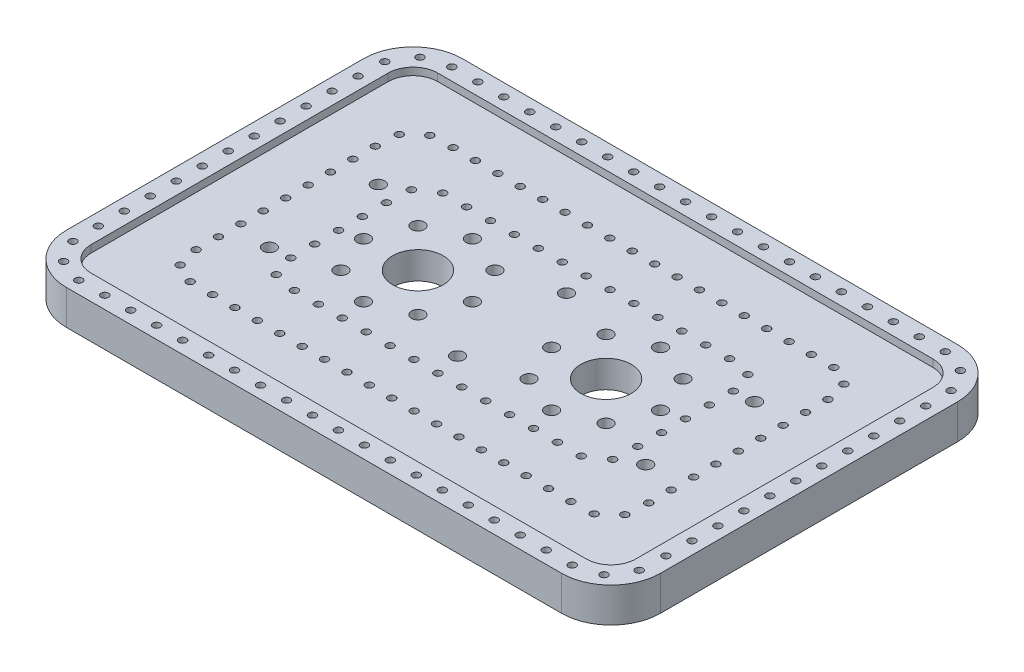
from build123d import *

# Parameters (mm, degrees)
SKETCH1_W                                        = 120
SKETCH1_H                                        = 80
BOSS_EXTRUDE1_DEPTH                              = 7
SKETCH2_W                                        = 110
SKETCH2_H                                        = 70
CUT_EXTRUDE1_DEPTH                               = 1.5
F_2_6_2_6_DIAMETER_HOLE1_D                       = 2.6
F_10_2_10_2_DIAMETER_HOLE1_D                     = 10.2
CBORE_FOR_M2_HEX_HEAD_MACHINE_SCREW1_D           = 2.6
CBORE_FOR_M2_HEX_HEAD_MACHINE_SCREW1_CBORE_D     = 5
CBORE_FOR_M2_HEX_HEAD_MACHINE_SCREW1_CBORE_DEPTH = 3
FILLET1_R                                        = 10
FILLET3_R                                        = 5
F_1_5MM_DOWEL_HOLE1_D                            = 1.5
CRVPATTERN1_OUTLINE_R                            = 0.75
CRVPATTERN1_DEPTH                                = 7
F_1_5MM_DOWEL_HOLE2_D                            = 1.5
CRVPATTERN3_OUTLINE_R                            = 0.75
CRVPATTERN3_DEPTH                                = 5.5
F_1_5MM_DOWEL_HOLE3_D                            = 1.5
CRVPATTERN4_OUTLINE_R                            = 0.75
CRVPATTERN4_DEPTH                                = 5.5


# Read off the part's stored shape, not the designer's step: CrvPattern1, CrvPattern3, CrvPattern4
with BuildPart() as part:
    # Sketch1 → Boss-Extrude1 (new body)
    with BuildSketch(Plane(origin=(0, 7, 0), x_dir=(1, 0, 0), z_dir=(0, 1, 0))):
        Rectangle(SKETCH1_W, SKETCH1_H)
    extrude(amount=-BOSS_EXTRUDE1_DEPTH)

    # Sketch2 → Cut-Extrude1 (cut)
    with BuildSketch(Plane(origin=(0, 7, 0), x_dir=(-1, 0, 0), z_dir=(0, 1, 0))):
        Rectangle(SKETCH2_W, SKETCH2_H)
    extrude(amount=-CUT_EXTRUDE1_DEPTH, mode=Mode.SUBTRACT)

    # Ø2.6 (2.6) Diameter Hole1 (through all)
    with Locations(Plane(origin=(0, 5.5, 0), x_dir=(1, 0, 0), z_dir=(0, 1, 0))):
        with Locations((-38, -11), (0, 11), (-11.221825407, -7.778174593), (-19, -11), (-26.778174593, -7.778174593), (-26.778174593, 7.778174593), (-19, 11), (-11.221825407, 7.778174593), (11.221825407, 7.778174593), (19, 11), (26.778174593, 7.778174593), (30, 0), (26.778174593, -7.778174593), (19, -11), (11.221825407, -7.778174593), (-8, 0)):
            Hole(F_2_6_2_6_DIAMETER_HOLE1_D / 2)

    # Ø10.2 (10.2) Diameter Hole1 (through all)
    with Locations(Plane(origin=(0, 5.5, 0), x_dir=(1, 0, 0), z_dir=(0, 1, 0))):
        with Locations((19, 0), (-19, 0)):
            Hole(F_10_2_10_2_DIAMETER_HOLE1_D / 2)

    # CBORE for M2 Hex Head Machine Screw1 (through all)
    with Locations(Plane(origin=(0, 0, 0), x_dir=(-1, 0, 0), z_dir=(0, -1, 0))):
        with Locations((-8, 0), (30, 0), (38, 11), (-38, 11), (0, -11), (-38, -11), (26.778174593, -7.778174593), (38, -11), (19, -11), (11.221825407, -7.778174593), (8, 0), (11.221825407, 7.778174593), (19, 11), (26.778174593, 7.778174593), (0, 11), (-11.221825407, 7.778174593), (-19, 11), (-26.778174593, 7.778174593), (-30, 0), (-26.778174593, -7.778174593), (-19, -11), (-11.221825407, -7.778174593)):
            CounterBoreHole(CBORE_FOR_M2_HEX_HEAD_MACHINE_SCREW1_D / 2, CBORE_FOR_M2_HEX_HEAD_MACHINE_SCREW1_CBORE_D / 2, CBORE_FOR_M2_HEX_HEAD_MACHINE_SCREW1_CBORE_DEPTH)

    # Fillet1
    fillet1_edges = [part.edges().sort_by_distance(p)[0] for p in [
        (-60, 3.5, -40),
        (60, 3.5, -40),
        (60, 3.5, 40),
        (-60, 3.5, 40),
    ]]
    fillet(fillet1_edges, radius=FILLET1_R)

    # Fillet3
    fillet3_edges = [part.edges().sort_by_distance(p)[0] for p in [
        (-55, 6.25, 35),
        (-55, 6.25, -35),
        (55, 6.25, -35),
        (55, 6.25, 35),
    ]]
    fillet(fillet3_edges, radius=FILLET3_R)

    # Ø1.5mm Dowel Hole1 (through all)
    with Locations(Plane(origin=(0, 7, 0), x_dir=(1, 0, 0), z_dir=(0, 1, 0))):
        with Locations((50, 37.5)):
            Hole(F_1_5MM_DOWEL_HOLE1_D / 2)

    # CrvPattern1 outline → CrvPattern1 (cut)
    with BuildSketch(Plane(origin=(0, 0, 0), x_dir=(1, 0, 0), z_dir=(0, 1, 0))):
        with Locations((44.755373003, 37.5)):
            Circle(CRVPATTERN1_OUTLINE_R)
        with Locations((39.510746006, 37.5)):
            Circle(CRVPATTERN1_OUTLINE_R)
        with Locations((34.266119008, 37.5)):
            Circle(CRVPATTERN1_OUTLINE_R)
        with Locations((29.021492011, 37.5)):
            Circle(CRVPATTERN1_OUTLINE_R)
        with Locations((23.776865014, 37.5)):
            Circle(CRVPATTERN1_OUTLINE_R)
        with Locations((18.532238017, 37.5)):
            Circle(CRVPATTERN1_OUTLINE_R)
        with Locations((13.28761102, 37.5)):
            Circle(CRVPATTERN1_OUTLINE_R)
        with Locations((8.042984022, 37.5)):
            Circle(CRVPATTERN1_OUTLINE_R)
        with Locations((2.798357025, 37.5)):
            Circle(CRVPATTERN1_OUTLINE_R)
        with Locations((-2.446269972, 37.5)):
            Circle(CRVPATTERN1_OUTLINE_R)
        with Locations((-7.690896969, 37.5)):
            Circle(CRVPATTERN1_OUTLINE_R)
        with Locations((-12.935523966, 37.5)):
            Circle(CRVPATTERN1_OUTLINE_R)
        with Locations((-18.180150964, 37.5)):
            Circle(CRVPATTERN1_OUTLINE_R)
        with Locations((-23.424777961, 37.5)):
            Circle(CRVPATTERN1_OUTLINE_R)
        with Locations((-28.669404958, 37.5)):
            Circle(CRVPATTERN1_OUTLINE_R)
        with Locations((-33.914031955, 37.5)):
            Circle(CRVPATTERN1_OUTLINE_R)
        with Locations((-39.158658952, 37.5)):
            Circle(CRVPATTERN1_OUTLINE_R)
        with Locations((-44.40328595, 37.5)):
            Circle(CRVPATTERN1_OUTLINE_R)
        with Locations((-49.647912947, 37.5)):
            Circle(CRVPATTERN1_OUTLINE_R)
        with Locations((-54.552848883, 35.959997236)):
            Circle(CRVPATTERN1_OUTLINE_R)
        with Locations((-57.320580195, 31.630676428)):
            Circle(CRVPATTERN1_OUTLINE_R)
        with Locations((-57.5, 26.399178513)):
            Circle(CRVPATTERN1_OUTLINE_R)
        with Locations((-57.5, 21.154551515)):
            Circle(CRVPATTERN1_OUTLINE_R)
        with Locations((-57.5, 15.909924518)):
            Circle(CRVPATTERN1_OUTLINE_R)
        with Locations((-57.5, 10.665297521)):
            Circle(CRVPATTERN1_OUTLINE_R)
        with Locations((-57.5, 5.420670524)):
            Circle(CRVPATTERN1_OUTLINE_R)
        with Locations((-57.5, 0.176043527)):
            Circle(CRVPATTERN1_OUTLINE_R)
        with Locations((-57.5, -5.068583471)):
            Circle(CRVPATTERN1_OUTLINE_R)
        with Locations((-57.5, -10.313210468)):
            Circle(CRVPATTERN1_OUTLINE_R)
        with Locations((-57.5, -15.557837465)):
            Circle(CRVPATTERN1_OUTLINE_R)
        with Locations((-57.5, -20.802464462)):
            Circle(CRVPATTERN1_OUTLINE_R)
        with Locations((-57.5, -26.047091459)):
            Circle(CRVPATTERN1_OUTLINE_R)
        with Locations((-57.389038921, -31.285341908)):
            Circle(CRVPATTERN1_OUTLINE_R)
        with Locations((-54.827521916, -35.739776316)):
            Circle(CRVPATTERN1_OUTLINE_R)
        with Locations((-50, -37.5)):
            Circle(CRVPATTERN1_OUTLINE_R)
        with Locations((-44.755373003, -37.5)):
            Circle(CRVPATTERN1_OUTLINE_R)
        with Locations((-39.510746006, -37.5)):
            Circle(CRVPATTERN1_OUTLINE_R)
        with Locations((-34.266119008, -37.5)):
            Circle(CRVPATTERN1_OUTLINE_R)
        with Locations((-29.021492011, -37.5)):
            Circle(CRVPATTERN1_OUTLINE_R)
        with Locations((-23.776865014, -37.5)):
            Circle(CRVPATTERN1_OUTLINE_R)
        with Locations((-18.532238017, -37.5)):
            Circle(CRVPATTERN1_OUTLINE_R)
        with Locations((-13.28761102, -37.5)):
            Circle(CRVPATTERN1_OUTLINE_R)
        with Locations((-8.042984022, -37.5)):
            Circle(CRVPATTERN1_OUTLINE_R)
        with Locations((-2.798357025, -37.5)):
            Circle(CRVPATTERN1_OUTLINE_R)
        with Locations((2.446269972, -37.5)):
            Circle(CRVPATTERN1_OUTLINE_R)
        with Locations((7.690896969, -37.5)):
            Circle(CRVPATTERN1_OUTLINE_R)
        with Locations((12.935523966, -37.5)):
            Circle(CRVPATTERN1_OUTLINE_R)
        with Locations((18.180150964, -37.5)):
            Circle(CRVPATTERN1_OUTLINE_R)
        with Locations((23.424777961, -37.5)):
            Circle(CRVPATTERN1_OUTLINE_R)
        with Locations((28.669404958, -37.5)):
            Circle(CRVPATTERN1_OUTLINE_R)
        with Locations((33.914031955, -37.5)):
            Circle(CRVPATTERN1_OUTLINE_R)
        with Locations((39.158658952, -37.5)):
            Circle(CRVPATTERN1_OUTLINE_R)
        with Locations((44.40328595, -37.5)):
            Circle(CRVPATTERN1_OUTLINE_R)
        with Locations((49.647912947, -37.5)):
            Circle(CRVPATTERN1_OUTLINE_R)
        with Locations((54.552848883, -35.959997236)):
            Circle(CRVPATTERN1_OUTLINE_R)
        with Locations((57.320580195, -31.630676428)):
            Circle(CRVPATTERN1_OUTLINE_R)
        with Locations((57.5, -26.399178513)):
            Circle(CRVPATTERN1_OUTLINE_R)
        with Locations((57.5, -21.154551515)):
            Circle(CRVPATTERN1_OUTLINE_R)
        with Locations((57.5, -15.909924518)):
            Circle(CRVPATTERN1_OUTLINE_R)
        with Locations((57.5, -10.665297521)):
            Circle(CRVPATTERN1_OUTLINE_R)
        with Locations((57.5, -5.420670524)):
            Circle(CRVPATTERN1_OUTLINE_R)
        with Locations((57.5, -0.176043527)):
            Circle(CRVPATTERN1_OUTLINE_R)
        with Locations((57.5, 5.068583471)):
            Circle(CRVPATTERN1_OUTLINE_R)
        with Locations((57.5, 10.313210468)):
            Circle(CRVPATTERN1_OUTLINE_R)
        with Locations((57.5, 15.557837465)):
            Circle(CRVPATTERN1_OUTLINE_R)
        with Locations((57.5, 20.802464462)):
            Circle(CRVPATTERN1_OUTLINE_R)
        with Locations((57.5, 26.047091459)):
            Circle(CRVPATTERN1_OUTLINE_R)
        with Locations((57.389038921, 31.285341908)):
            Circle(CRVPATTERN1_OUTLINE_R)
        with Locations((54.827521916, 35.739776316)):
            Circle(CRVPATTERN1_OUTLINE_R)
    extrude(amount=CRVPATTERN1_DEPTH, mode=Mode.SUBTRACT)

    # Ø1.5mm Dowel Hole2 (through all)
    with Locations(Plane(origin=(0, 5.5, 0), x_dir=(1, 0, 0), z_dir=(0, 1, 0))):
        with Locations((40, 25)):
            Hole(F_1_5MM_DOWEL_HOLE2_D / 2)

    # CrvPattern3 outline → CrvPattern3 (cut)
    with BuildSketch(Plane(origin=(0, 0, 0), x_dir=(1, 0, 0), z_dir=(0, 1, 0))):
        with Locations((35.476401224, 25)):
            Circle(CRVPATTERN3_OUTLINE_R)
        with Locations((30.952802449, 25)):
            Circle(CRVPATTERN3_OUTLINE_R)
        with Locations((26.429203673, 25)):
            Circle(CRVPATTERN3_OUTLINE_R)
        with Locations((21.905604898, 25)):
            Circle(CRVPATTERN3_OUTLINE_R)
        with Locations((17.382006122, 25)):
            Circle(CRVPATTERN3_OUTLINE_R)
        with Locations((12.858407346, 25)):
            Circle(CRVPATTERN3_OUTLINE_R)
        with Locations((8.334808571, 25)):
            Circle(CRVPATTERN3_OUTLINE_R)
        with Locations((3.811209795, 25)):
            Circle(CRVPATTERN3_OUTLINE_R)
        with Locations((-0.71238898, 25)):
            Circle(CRVPATTERN3_OUTLINE_R)
        with Locations((-5.235987756, 25)):
            Circle(CRVPATTERN3_OUTLINE_R)
        with Locations((-9.759586532, 25)):
            Circle(CRVPATTERN3_OUTLINE_R)
        with Locations((-14.283185307, 25)):
            Circle(CRVPATTERN3_OUTLINE_R)
        with Locations((-18.806784083, 25)):
            Circle(CRVPATTERN3_OUTLINE_R)
        with Locations((-23.330382858, 25)):
            Circle(CRVPATTERN3_OUTLINE_R)
        with Locations((-27.853981634, 25)):
            Circle(CRVPATTERN3_OUTLINE_R)
        with Locations((-32.37758041, 25)):
            Circle(CRVPATTERN3_OUTLINE_R)
        with Locations((-36.901179185, 25)):
            Circle(CRVPATTERN3_OUTLINE_R)
        with Locations((-41.405574173, 24.798370687)):
            Circle(CRVPATTERN3_OUTLINE_R)
        with Locations((-44.64124129, 21.859806251)):
            Circle(CRVPATTERN3_OUTLINE_R)
        with Locations((-45, 17.382006122)):
            Circle(CRVPATTERN3_OUTLINE_R)
        with Locations((-45, 12.858407346)):
            Circle(CRVPATTERN3_OUTLINE_R)
        with Locations((-45, 8.334808571)):
            Circle(CRVPATTERN3_OUTLINE_R)
        with Locations((-45, 3.811209795)):
            Circle(CRVPATTERN3_OUTLINE_R)
        with Locations((-45, -0.71238898)):
            Circle(CRVPATTERN3_OUTLINE_R)
        with Locations((-45, -5.235987756)):
            Circle(CRVPATTERN3_OUTLINE_R)
        with Locations((-45, -9.759586532)):
            Circle(CRVPATTERN3_OUTLINE_R)
        with Locations((-45, -14.283185307)):
            Circle(CRVPATTERN3_OUTLINE_R)
        with Locations((-45, -18.806784083)):
            Circle(CRVPATTERN3_OUTLINE_R)
        with Locations((-43.931260104, -23.089529736)):
            Circle(CRVPATTERN3_OUTLINE_R)
        with Locations((-40, -25)):
            Circle(CRVPATTERN3_OUTLINE_R)
        with Locations((-35.476401224, -25)):
            Circle(CRVPATTERN3_OUTLINE_R)
        with Locations((-30.952802449, -25)):
            Circle(CRVPATTERN3_OUTLINE_R)
        with Locations((-26.429203673, -25)):
            Circle(CRVPATTERN3_OUTLINE_R)
        with Locations((-21.905604898, -25)):
            Circle(CRVPATTERN3_OUTLINE_R)
        with Locations((-17.382006122, -25)):
            Circle(CRVPATTERN3_OUTLINE_R)
        with Locations((-12.858407346, -25)):
            Circle(CRVPATTERN3_OUTLINE_R)
        with Locations((-8.334808571, -25)):
            Circle(CRVPATTERN3_OUTLINE_R)
        with Locations((-3.811209795, -25)):
            Circle(CRVPATTERN3_OUTLINE_R)
        with Locations((0.71238898, -25)):
            Circle(CRVPATTERN3_OUTLINE_R)
        with Locations((5.235987756, -25)):
            Circle(CRVPATTERN3_OUTLINE_R)
        with Locations((9.759586532, -25)):
            Circle(CRVPATTERN3_OUTLINE_R)
        with Locations((14.283185307, -25)):
            Circle(CRVPATTERN3_OUTLINE_R)
        with Locations((18.806784083, -25)):
            Circle(CRVPATTERN3_OUTLINE_R)
        with Locations((23.330382858, -25)):
            Circle(CRVPATTERN3_OUTLINE_R)
        with Locations((27.853981634, -25)):
            Circle(CRVPATTERN3_OUTLINE_R)
        with Locations((32.37758041, -25)):
            Circle(CRVPATTERN3_OUTLINE_R)
        with Locations((36.901179185, -25)):
            Circle(CRVPATTERN3_OUTLINE_R)
        with Locations((41.405574173, -24.798370687)):
            Circle(CRVPATTERN3_OUTLINE_R)
        with Locations((44.64124129, -21.859806251)):
            Circle(CRVPATTERN3_OUTLINE_R)
        with Locations((45, -17.382006122)):
            Circle(CRVPATTERN3_OUTLINE_R)
        with Locations((45, -12.858407346)):
            Circle(CRVPATTERN3_OUTLINE_R)
        with Locations((45, -8.334808571)):
            Circle(CRVPATTERN3_OUTLINE_R)
        with Locations((45, -3.811209795)):
            Circle(CRVPATTERN3_OUTLINE_R)
        with Locations((45, 0.71238898)):
            Circle(CRVPATTERN3_OUTLINE_R)
        with Locations((45, 5.235987756)):
            Circle(CRVPATTERN3_OUTLINE_R)
        with Locations((45, 9.759586532)):
            Circle(CRVPATTERN3_OUTLINE_R)
        with Locations((45, 14.283185307)):
            Circle(CRVPATTERN3_OUTLINE_R)
        with Locations((45, 18.806784083)):
            Circle(CRVPATTERN3_OUTLINE_R)
        with Locations((43.931260104, 23.089529736)):
            Circle(CRVPATTERN3_OUTLINE_R)
    extrude(amount=CRVPATTERN3_DEPTH, mode=Mode.SUBTRACT)

    # Ø1.5mm Dowel Hole3 (through all)
    with Locations(Plane(origin=(0, 0, 0), x_dir=(-1, 0, 0), z_dir=(0, -1, 0))):
        with Locations((-30, -16)):
            Hole(F_1_5MM_DOWEL_HOLE3_D / 2)

    # CrvPattern4 outline → CrvPattern4 (cut)
    with BuildSketch(Plane(origin=(0, 0, 0), x_dir=(1, 0, 0), z_dir=(0, 1, 0))):
        with Locations((25.171681469, -16)):
            Circle(CRVPATTERN4_OUTLINE_R)
        with Locations((20.343362939, -16)):
            Circle(CRVPATTERN4_OUTLINE_R)
        with Locations((15.515044408, -16)):
            Circle(CRVPATTERN4_OUTLINE_R)
        with Locations((10.686725877, -16)):
            Circle(CRVPATTERN4_OUTLINE_R)
        with Locations((5.858407346, -16)):
            Circle(CRVPATTERN4_OUTLINE_R)
        with Locations((1.030088816, -16)):
            Circle(CRVPATTERN4_OUTLINE_R)
        with Locations((-3.798229715, -16)):
            Circle(CRVPATTERN4_OUTLINE_R)
        with Locations((-8.626548246, -16)):
            Circle(CRVPATTERN4_OUTLINE_R)
        with Locations((-13.454866776, -16)):
            Circle(CRVPATTERN4_OUTLINE_R)
        with Locations((-18.283185307, -16)):
            Circle(CRVPATTERN4_OUTLINE_R)
        with Locations((-23.111503838, -16)):
            Circle(CRVPATTERN4_OUTLINE_R)
        with Locations((-27.939822369, -16)):
            Circle(CRVPATTERN4_OUTLINE_R)
        with Locations((-32.552422087, -15.079795689)):
            Circle(CRVPATTERN4_OUTLINE_R)
        with Locations((-34, -10.686725877)):
            Circle(CRVPATTERN4_OUTLINE_R)
        with Locations((-34, -5.858407346)):
            Circle(CRVPATTERN4_OUTLINE_R)
        with Locations((-34, -1.030088816)):
            Circle(CRVPATTERN4_OUTLINE_R)
        with Locations((-34, 3.798229715)):
            Circle(CRVPATTERN4_OUTLINE_R)
        with Locations((-34, 8.626548246)):
            Circle(CRVPATTERN4_OUTLINE_R)
        with Locations((-33.738324268, 13.423000937)):
            Circle(CRVPATTERN4_OUTLINE_R)
        with Locations((-30, 16)):
            Circle(CRVPATTERN4_OUTLINE_R)
        with Locations((-25.171681469, 16)):
            Circle(CRVPATTERN4_OUTLINE_R)
        with Locations((-20.343362939, 16)):
            Circle(CRVPATTERN4_OUTLINE_R)
        with Locations((-15.515044408, 16)):
            Circle(CRVPATTERN4_OUTLINE_R)
        with Locations((-10.686725877, 16)):
            Circle(CRVPATTERN4_OUTLINE_R)
        with Locations((-5.858407346, 16)):
            Circle(CRVPATTERN4_OUTLINE_R)
        with Locations((-1.030088816, 16)):
            Circle(CRVPATTERN4_OUTLINE_R)
        with Locations((3.798229715, 16)):
            Circle(CRVPATTERN4_OUTLINE_R)
        with Locations((8.626548246, 16)):
            Circle(CRVPATTERN4_OUTLINE_R)
        with Locations((13.454866776, 16)):
            Circle(CRVPATTERN4_OUTLINE_R)
        with Locations((18.283185307, 16)):
            Circle(CRVPATTERN4_OUTLINE_R)
        with Locations((23.111503838, 16)):
            Circle(CRVPATTERN4_OUTLINE_R)
        with Locations((27.939822369, 16)):
            Circle(CRVPATTERN4_OUTLINE_R)
        with Locations((32.552422087, 15.079795689)):
            Circle(CRVPATTERN4_OUTLINE_R)
        with Locations((34, 10.686725877)):
            Circle(CRVPATTERN4_OUTLINE_R)
        with Locations((34, 5.858407346)):
            Circle(CRVPATTERN4_OUTLINE_R)
        with Locations((34, 1.030088816)):
            Circle(CRVPATTERN4_OUTLINE_R)
        with Locations((34, -3.798229715)):
            Circle(CRVPATTERN4_OUTLINE_R)
        with Locations((34, -8.626548246)):
            Circle(CRVPATTERN4_OUTLINE_R)
        with Locations((33.738324268, -13.423000937)):
            Circle(CRVPATTERN4_OUTLINE_R)
    extrude(amount=CRVPATTERN4_DEPTH, mode=Mode.SUBTRACT)


solid = part.part
